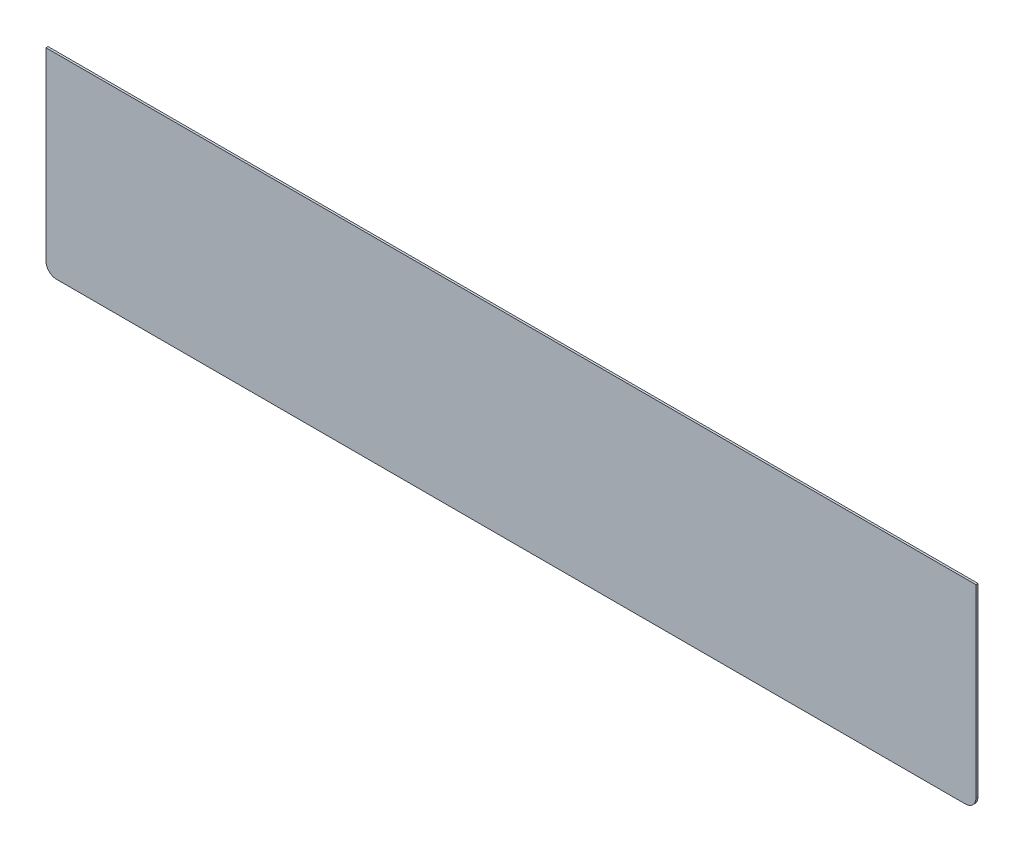
from build123d import *

# Parameters (mm, degrees)
SKETCH1_W          = 220.8
SKETCH1_H          = 92.7366
BASE_FLANGE_DEPTH  = 1
BREAK_CORNER_DEPTH = 1


# Read off the part's stored shape, not the designer's step: Break-Corner
# Sheet-metal steps are written as plain solids
with BuildPart() as part:
    # Sketch1 → Base-Flange (new body)
    with BuildSketch(Plane.XY):
        with Locations((110.4, 136.6169868)):
            Rectangle(SKETCH1_W, SKETCH1_H)
    extrude(amount=BASE_FLANGE_DEPTH)

    # Break-Corner outline → Break-Corner (cut)
    with BuildSketch(Plane.XY):
        with BuildLine():
            Line((220.8, 90.2486868), (220.8, 95.2486868))
            ThreePointArc((220.8, 95.2486868), (219.335533906, 91.713152894), (215.8, 90.2486868))
            Line((215.8, 90.2486868), (220.8, 90.2486868))
        make_face()
    extrude(amount=BREAK_CORNER_DEPTH, mode=Mode.SUBTRACT)

    # Mirror-Vertical: part across plane


with BuildPart() as part_1:
    add(part.part)
    add(part.part.mirror(Plane(origin=(0, 182.9852868, 1), x_dir=(0, 0, 1), z_dir=(1, 0, 0))))


solid = part_1.part
